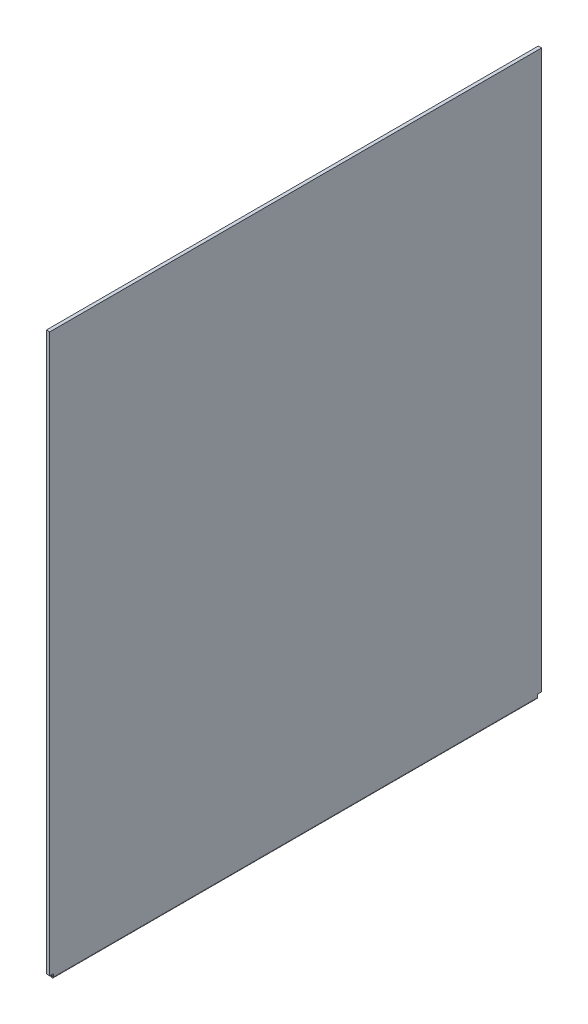
from build123d import *

# Parameters (mm, degrees)
SKETCH1_W              = 711.2
SKETCH1_H              = 812.8
BOSS_EXTRUDE1_DEPTH    = 4.8
FILLET1_R              = 2.4
CUT_EXTRUDE3_START     = -5.6
CUT_EXTRUDE3_OUTLINE_W = 5
CUT_EXTRUDE3_OUTLINE_H = 7
CUT_EXTRUDE3_DEPTH     = 5.6
SKETCH2_R              = 1
CUT_EXTRUDE1_DEPTH     = 10


# Read off the part's stored shape, not the designer's step: Cut-Extrude3
with BuildPart() as part:
    # Sketch1 → Boss-Extrude1 (new body)
    with BuildSketch(Plane(origin=(0, 0, 0), x_dir=(0, 0, -1), z_dir=(1, 0, 0))):
        Rectangle(SKETCH1_W, SKETCH1_H)
    extrude(amount=BOSS_EXTRUDE1_DEPTH)

    # Fillet1
    fillet1_edges = [part.edges().sort_by_distance(p)[0] for p in [
        (4.8, -406.4, 0),
        (0, -406.4, 0),
    ]]
    fillet(fillet1_edges, radius=FILLET1_R - 0.0001)  # a hair under: the kernel refuses the full size

    # Cut-Extrude3 outline → Cut-Extrude3 (cut)
    with BuildSketch(Plane.XY.offset(355.6).offset(CUT_EXTRUDE3_START)):
        with Locations((2.5, -403.5)):
            Rectangle(CUT_EXTRUDE3_OUTLINE_W, CUT_EXTRUDE3_OUTLINE_H)
    cut_extrude3 = extrude(amount=CUT_EXTRUDE3_DEPTH, mode=Mode.SUBTRACT)

    # Sketch2 → Cut-Extrude1 (cut)
    with BuildSketch(Plane.XY.offset(355.6)):
        with Locations((2.4, -404)):
            Circle(SKETCH2_R)
    cut_extrude1 = extrude(amount=-CUT_EXTRUDE1_DEPTH, mode=Mode.SUBTRACT)

    # Mirror1: Cut-Extrude1 across plane
    add(cut_extrude1.mirror(Plane.XY), mode=Mode.SUBTRACT)

    # Mirror4: Cut-Extrude3 across plane
    add(cut_extrude3.mirror(Plane.XY), mode=Mode.SUBTRACT)


solid = part.part
